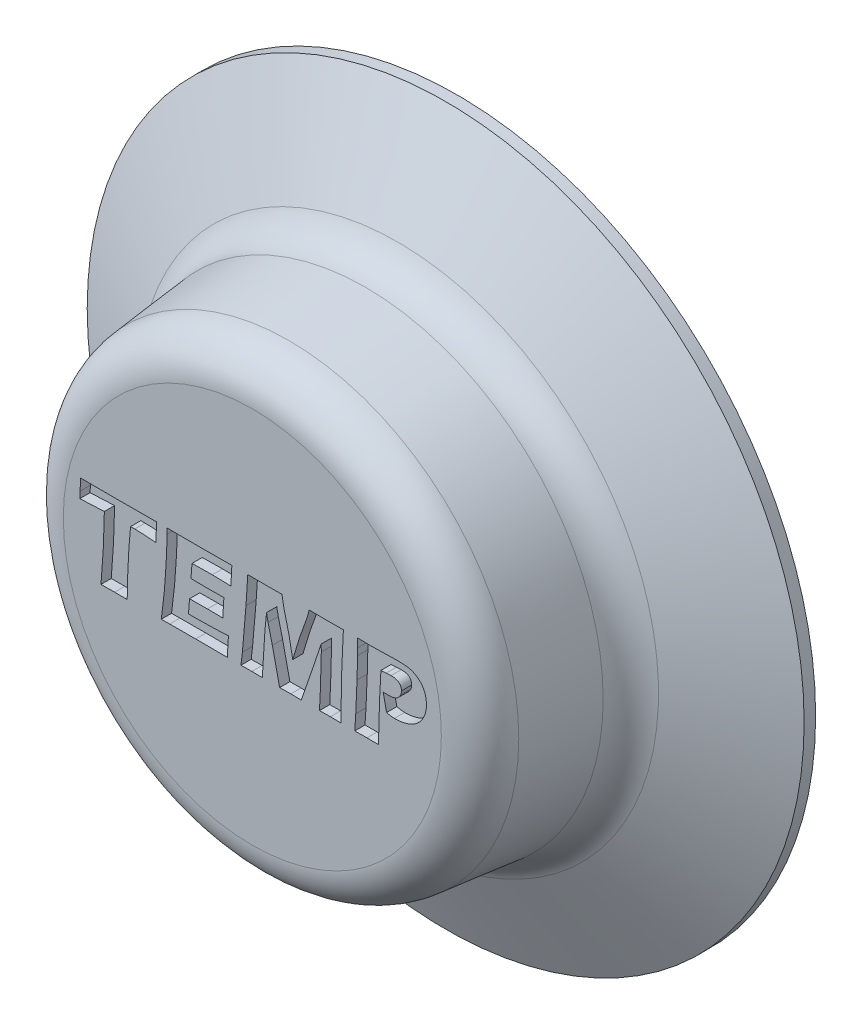
from build123d import *

# Parameters (mm, degrees)
SCHIZZO1_R                   = 17.5
ESTRUSIONE_ESTRUSIONE1_DEPTH = 10
TAGLIO_ESTRUSIONE1_START     = -7
SCHIZZO2_R                   = 17.5
SCHIZZO2_R_2                 = 12.5
TAGLIO_ESTRUSIONE1_DEPTH     = 7
SMUSSO1_SIZE                 = 2.438662943
SMUSSO1_SIZE_2               = 5
RACCORDO1_R                  = 2
TAGLIO_ESTRUSIONE2_DEPTH     = 0.5
TAGLIO_ESTRUSIONE3_DEPTH     = 8
SMUSSO3_SIZE                 = 2


with BuildPart() as part:
    # Schizzo1 → Estrusione-Estrusione1 (new body)
    with BuildSketch(Plane.XY):
        Circle(SCHIZZO1_R)
    extrude(amount=ESTRUSIONE_ESTRUSIONE1_DEPTH)

    # Schizzo2 → Taglio-Estrusione1 (cut)
    with BuildSketch(Plane.XY.offset(10).offset(TAGLIO_ESTRUSIONE1_START)):
        Circle(SCHIZZO2_R)
        Circle(SCHIZZO2_R_2, mode=Mode.SUBTRACT)
    extrude(amount=TAGLIO_ESTRUSIONE1_DEPTH, mode=Mode.SUBTRACT)

    # Smusso1
    # the kernel refuses this chamfer: 5, 2.438662943 mm, written as the material it takes off along each edge
    with BuildSketch(Plane(origin=(0, 0, 3), x_dir=(1, 0, 0), z_dir=(0, -1, 0))) as smusso1_piece_1_section:
        Polygon((17.5, -SMUSSO1_SIZE), (17.5 - SMUSSO1_SIZE_2, 0), (17.5, 0), align=None)
    smusso1_piece_1 = revolve(axis=Axis((0, 0, 3), (0, 0, 1)), mode=Mode.PRIVATE)
    smusso1_piece_1 = smusso1_piece_1 - Plane(origin=(0, 0, 3), x_dir=(1, 0, 0), z_dir=(0, 0, -1)) * Cylinder(12.5, 71, mode=Mode.PRIVATE)
    add(smusso1_piece_1, mode=Mode.SUBTRACT)

    # Smusso2: read off the stored shape, not the designer's step
    # Smusso2 outline → Smusso2 (revolve, cut)
    with BuildSketch(Plane.XZ):
        Polygon((11.028540706, 10), (11.724516951, 3.378228355), (12.5, 3), (12.5, 10), align=None)
    revolve(axis=Axis((0, 0, 0), (0, 0, 1)), mode=Mode.SUBTRACT)

    # Raccordo1
    raccordo1_edges = [part.edges().sort_by_distance(p)[0] for p in [
        (-11.028540706, 0, 10),
        (-11.724516951, 0, 3.378228355),
    ]]
    fillet(raccordo1_edges, radius=RACCORDO1_R)

    # Schizzo3 → Taglio-Estrusione2 (cut)
    with BuildSketch(Plane.XY.offset(10)):
        with BuildLine():
            add(Edge.make_bspline(
                [(-7.388888889, -1.892822573), (-7.377505654, -1.771617162), (-7.354453879, -1.526168483), (-7.326689975, -1.152761265), (-7.300352082, -0.770267216), (-7.277566086, -0.378772925), (-7.259963473, 0.021474924), (-7.244005216, 0.430605824), (-7.231813049, 0.849028689), (-7.226596004, 1.131188002), (-7.223958333, 1.273844094)],
                knots=[0, 0, 0, 0, 0.921146344, 1.86538004, 2.833160902, 3.822244263, 4.832629341, 5.864615056, 6.920377047, 8, 8, 8, 8], degree=3))
            Line((-7.223958333, 1.273844094), (-8.421006944, 1.218288539))
            Line((-8.421006944, 1.218288539), (-8.40625, 1.54033715))
            add(Edge.make_bspline(
                [(-8.40625, 1.54033715), (-8.402454403, 1.630604916), (-8.394512338, 1.819484957), (-8.390817779, 2.008496498), (-8.388888889, 2.107177427)],
                knots=[0, 0, 0, 0, 0.955821121, 2, 2, 2, 2], degree=3))
            add(Edge.make_bspline(
                [(-8.388888889, 2.107177427), (-8.318576868, 2.106520313), (-8.175061235, 2.105179061), (-7.955728798, 2.104627017), (-7.727720092, 2.103670757), (-7.491319484, 2.102813657), (-7.246238387, 2.102013711), (-6.993056482, 2.100845887), (-6.731192016, 2.101168389), (-6.553819406, 2.101123756), (-6.463541667, 2.101101039)],
                knots=[0, 0, 0, 0, 0.876488081, 1.789021852, 2.734016799, 3.718686541, 4.735817494, 5.789016475, 6.874670702, 8, 8, 8, 8], degree=3))
            Line((-6.463541667, 2.101101039), (-5.744791667, 2.104573261))
            Line((-5.744791667, 2.104573261), (-5.046875, 2.104573261))
            Line((-5.046875, 2.104573261), (-4.668402778, 2.107177427))
            Line((-4.668402778, 2.107177427), (-4.685763889, 1.822455205))
            add(Edge.make_bspline(
                [(-4.685763889, 1.822455205), (-4.687410602, 1.785992556), (-4.690547571, 1.716531621), (-4.696438008, 1.61705371), (-4.699511606, 1.52732116), (-4.702367522, 1.447177436), (-4.703759381, 1.376846822), (-4.705796845, 1.315809453), (-4.706744646, 1.264009233), (-4.70664294, 1.232466993), (-4.706597222, 1.218288539)],
                knots=[0, 0, 0, 0, 1.448901192, 2.76014038, 3.955588437, 5.012880538, 5.943546328, 6.747908458, 7.437176186, 8, 8, 8, 8], degree=3))
            add(Edge.make_bspline(
                [(-4.706597222, 1.218288539), (-4.757515566, 1.222720686), (-4.8572944, 1.231405858), (-5.003432122, 1.242566477), (-5.142895775, 1.25225033), (-5.275426877, 1.260046721), (-5.401300234, 1.26617986), (-5.520231629, 1.270528398), (-5.632220533, 1.273296467), (-5.704570309, 1.273665503), (-5.739583333, 1.273844094)],
                knots=[0, 0, 0, 0, 1.185412133, 2.322916112, 3.399205445, 4.427758314, 5.401981809, 6.321996416, 7.187945247, 8, 8, 8, 8], degree=3))
            Line((-5.739583333, 1.273844094), (-5.944444444, 1.273844094))
            add(Edge.make_bspline(
                [(-5.944444444, 1.273844094), (-5.952941435, 1.188495573), (-5.96961338, 1.021033225), (-5.992339161, 0.774536845), (-6.011591034, 0.537841018), (-6.021882061, 0.38323214), (-6.026909722, 0.307698261)],
                knots=[0, 0, 0, 0, 1.06138436, 2.082542449, 3.063229686, 4, 4, 4, 4], degree=3))
            add(Edge.make_bspline(
                [(-6.026909722, 0.307698261), (-6.039070188, 0.099105913), (-6.063029625, -0.311877949), (-6.082184048, -0.771817222), (-6.092892146, -1.069316722), (-6.097367542, -1.208204081), (-6.100389083, -1.339878731), (-6.104592871, -1.464270731), (-6.105773497, -1.581482958), (-6.107464479, -1.691724637), (-6.109798693, -1.79472391), (-6.109512475, -1.860992726), (-6.109375, -1.892822573)],
                knots=[0, 0, 0, 0, 2.84620581, 5.607802343, 6.270399841, 6.901350865, 7.500669288, 8.064527081, 8.596690644, 9.097325726, 9.566432822, 10, 10, 10, 10], degree=3))
            add(Edge.make_bspline(
                [(-6.109375, -1.892822573), (-6.147279219, -1.892169908), (-6.219323418, -1.890929394), (-6.322338828, -1.89030185), (-6.414641755, -1.889409344), (-6.496817453, -1.888501942), (-6.568288821, -1.887789409), (-6.629336664, -1.886535569), (-6.679687771, -1.886783081), (-6.709780176, -1.886757499), (-6.723090278, -1.886746184)],
                knots=[0, 0, 0, 0, 1.482402954, 2.817589569, 4.028319032, 5.091964258, 6.031155381, 6.823267612, 7.479522213, 8, 8, 8, 8], degree=3))
            add(Edge.make_bspline(
                [(-6.723090278, -1.886746184), (-6.73553234, -1.886755748), (-6.765046069, -1.886778437), (-6.815686303, -1.886540344), (-6.879338459, -1.887799423), (-6.956018033, -1.888520683), (-7.045717137, -1.889404019), (-7.148725959, -1.890317732), (-7.264472328, -1.890922603), (-7.346065598, -1.892168617), (-7.388888889, -1.892822573)],
                knots=[0, 0, 0, 0, 0.448477953, 1.063831424, 1.825272406, 2.743147011, 3.827888016, 5.058639151, 6.456260527, 8, 8, 8, 8], degree=3))
        make_face()
        with BuildLine():
            add(Edge.make_bspline(
                [(-4.444444444, -1.892822573), (-4.435878044, -1.831213501), (-4.419076912, -1.710380706), (-4.39740589, -1.532816398), (-4.374701843, -1.363162433), (-4.356515689, -1.200944493), (-4.337399876, -1.046596326), (-4.322605611, -0.899738956), (-4.306984561, -0.760995016), (-4.295306166, -0.626603199), (-4.282154997, -0.491008744), (-4.271634539, -0.347664808), (-4.25907547, -0.193786008), (-4.246788523, -0.029457608), (-4.23615894, 0.145393607), (-4.22319987, 0.330492377), (-4.212765659, 0.526181658), (-4.200370893, 0.727522401), (-4.189477005, 0.925156569), (-4.1797162, 1.109755355), (-4.172400221, 1.276746847), (-4.164490998, 1.425702635), (-4.161308302, 1.556855134), (-4.15581191, 1.669928383), (-4.154546594, 1.765450754), (-4.153925369, 1.82332362), (-4.153645833, 1.849364927)],
                knots=[0, 0, 0, 0, 1.19249449, 2.338818581, 3.429412686, 4.473928193, 5.46821108, 6.411021954, 7.303599658, 8.144847551, 8.99714345, 9.915298701, 10.900252692, 11.957113468, 13.074467758, 14.258610572, 15.514392259, 16.831414631, 18.125965857, 19.309133721, 20.375401368, 21.330583298, 22.168697699, 22.890391102, 23.50070443, 24, 24, 24, 24], degree=3))
            Line((-4.153645833, 1.849364927), (-4.157118056, 2.107177427))
            add(Edge.make_bspline(
                [(-4.157118056, 2.107177427), (-4.100116332, 2.106519937), (-3.982932453, 2.105168271), (-3.802950929, 2.104626538), (-3.61400488, 2.103665775), (-3.416666719, 2.102812167), (-3.210358776, 2.102007254), (-2.995371464, 2.100843995), (-2.771411902, 2.101169311), (-2.619212917, 2.101124083), (-2.541666667, 2.101101039)],
                knots=[0, 0, 0, 0, 0.846890532, 1.741033624, 2.673864724, 3.653981213, 4.67278578, 5.738875813, 6.847944331, 8, 8, 8, 8], degree=3))
            add(Edge.make_bspline(
                [(-2.541666667, 2.101101039), (-2.400173206, 2.100925967), (-2.125865605, 2.100586562), (-1.727430987, 2.102960826), (-1.355030946, 2.10422844), (-1.115450863, 2.10621846), (-1, 2.107177427)],
                knots=[0, 0, 0, 0, 1.101338765, 2.135120547, 3.101336221, 4, 4, 4, 4], degree=3))
            Line((-1, 2.107177427), (-1.005208333, 2.008219094))
            add(Edge.make_bspline(
                [(-1.005208333, 2.008219094), (-1.006153453, 1.998386372), (-1.008789708, 1.970959625), (-1.010411331, 1.9176166), (-1.015460168, 1.840708265), (-1.018337371, 1.781373645), (-1.019965278, 1.747802427)],
                knots=[0, 0, 0, 0, 0.454335529, 1.267293612, 2.453849006, 4, 4, 4, 4], degree=3))
            Line((-1.019965278, 1.747802427), (-1.036458333, 1.421413539))
            add(Edge.make_bspline(
                [(-1.036458333, 1.421413539), (-1.038122368, 1.38611883), (-1.041462892, 1.315265261), (-1.042176559, 1.244336517), (-1.042534722, 1.208739927)],
                knots=[0, 0, 0, 0, 0.996271834, 2, 2, 2, 2], degree=3))
            add(Edge.make_bspline(
                [(-1.042534722, 1.208739927), (-1.129332367, 1.212434846), (-1.295664578, 1.219515498), (-1.534409841, 1.226153736), (-1.75142864, 1.230863334), (-1.888886796, 1.231755065), (-1.953993056, 1.232177427)],
                knots=[0, 0, 0, 0, 1.143319042, 2.190967089, 3.14316204, 4, 4, 4, 4], degree=3))
            add(Edge.make_bspline(
                [(-1.953993056, 1.232177427), (-1.986400435, 1.232173473), (-2.048611031, 1.232165881), (-2.137731762, 1.232217636), (-2.218459749, 1.232048603), (-2.290803398, 1.232583344), (-2.355029768, 1.230907034), (-2.411175495, 1.231758123), (-2.459196439, 1.230163648), (-2.51533839, 1.230658838), (-2.589134861, 1.229675426), (-2.689815969, 1.226726581), (-2.810495866, 1.223567898), (-2.897573087, 1.220135895), (-2.944444444, 1.218288539)],
                knots=[0, 0, 0, 0, 1.177678137, 2.260721423, 3.238614876, 4.111358495, 4.889538308, 5.573012226, 6.151431894, 6.635121129, 7.613071112, 8.833217023, 10.295404764, 12, 12, 12, 12], degree=3))
            Line((-2.944444444, 1.218288539), (-2.996527778, 0.551621872))
            add(Edge.make_bspline(
                [(-2.996527778, 0.551621872), (-2.939237483, 0.550388199), (-2.819744665, 0.547815076), (-2.633685704, 0.545358712), (-2.433741594, 0.54358067), (-2.296007354, 0.543159155), (-2.224826389, 0.542941316)],
                knots=[0, 0, 0, 0, 0.890998197, 1.858393033, 2.893218922, 4, 4, 4, 4], degree=3))
            add(Edge.make_bspline(
                [(-2.224826389, 0.542941316), (-2.208911569, 0.542874741), (-2.171871462, 0.542719795), (-2.108223265, 0.544312902), (-2.028345718, 0.543184116), (-1.932013324, 0.546195471), (-1.819148324, 0.546074147), (-1.690107004, 0.548390961), (-1.544850178, 0.549942498), (-1.442708323, 0.55104235), (-1.388888889, 0.551621872)],
                knots=[0, 0, 0, 0, 0.456874731, 1.063328995, 1.827555819, 2.749761755, 3.829679432, 5.067506109, 6.454843409, 8, 8, 8, 8], degree=3))
            add(Edge.make_bspline(
                [(-1.388888889, 0.551621872), (-1.39358665, 0.486522556), (-1.403418517, 0.35027726), (-1.417398464, 0.13704228), (-1.43015038, -0.094186939), (-1.438418003, -0.254220535), (-1.442708333, -0.337267017)],
                knots=[0, 0, 0, 0, 0.879491857, 1.840674164, 2.879457706, 4, 4, 4, 4], degree=3))
            add(Edge.make_bspline(
                [(-1.442708333, -0.337267017), (-1.48205933, -0.336611838), (-1.55873299, -0.33533525), (-1.670139722, -0.334746029), (-1.77459506, -0.333818644), (-1.871817326, -0.332937618), (-1.962095696, -0.332173761), (-2.045425516, -0.33096013), (-2.121817392, -0.331240282), (-2.170428325, -0.331206646), (-2.193576389, -0.331190628)],
                knots=[0, 0, 0, 0, 1.257885333, 2.450933417, 3.560750778, 4.596585635, 5.558438414, 6.446309642, 7.260147448, 8, 8, 8, 8], degree=3))
            add(Edge.make_bspline(
                [(-2.193576389, -0.331190628), (-2.260417295, -0.331043243), (-2.398152433, -0.330739534), (-2.610530953, -0.333166363), (-2.834495261, -0.334450053), (-2.987558612, -0.336312761), (-3.065972222, -0.337267017)],
                knots=[0, 0, 0, 0, 0.919373236, 1.894498551, 2.921361849, 4, 4, 4, 4], degree=3))
            Line((-3.065972222, -0.337267017), (-3.118055556, -1.003933684))
            Line((-3.118055556, -1.003933684), (-2.791666667, -1.003933684))
            add(Edge.make_bspline(
                [(-2.791666667, -1.003933684), (-2.778066648, -1.0039896), (-2.747391813, -1.004115721), (-2.696761035, -1.002915023), (-2.636286144, -1.002111234), (-2.566253896, -1.001486982), (-2.486403777, -0.999422041), (-2.396703644, -0.997738977), (-2.297445032, -0.996251601), (-2.228007847, -0.994453559), (-2.191840278, -0.993517017)],
                knots=[0, 0, 0, 0, 0.54404726, 1.227098294, 2.02588985, 2.963574664, 4.028769848, 5.221268376, 6.55264914, 8, 8, 8, 8], degree=3))
            Line((-2.191840278, -0.993517017), (-1.604166667, -0.976155906))
            add(Edge.make_bspline(
                [(-1.604166667, -0.976155906), (-1.578703369, -0.975013007), (-1.520241942, -0.972389015), (-1.421794943, -0.96758351), (-1.301513631, -0.958068032), (-1.214124258, -0.95178836), (-1.166666667, -0.948378128)],
                knots=[0, 0, 0, 0, 0.697681804, 1.601814284, 2.697643508, 4, 4, 4, 4], degree=3))
            add(Edge.make_bspline(
                [(-1.166666667, -0.948378128), (-1.177578217, -1.103151296), (-1.199759534, -1.4177787), (-1.215805688, -1.732778919), (-1.223958333, -1.892822573)],
                knots=[0, 0, 0, 0, 0.983850526, 2, 2, 2, 2], degree=3))
            add(Edge.make_bspline(
                [(-1.223958333, -1.892822573), (-1.344038851, -1.891864602), (-1.58998494, -1.88990251), (-1.967303739, -1.888628419), (-2.36139802, -1.886243865), (-2.629629235, -1.886576472), (-2.766493056, -1.886746184)],
                knots=[0, 0, 0, 0, 0.934172669, 1.913350473, 2.935296078, 4, 4, 4, 4], degree=3))
            Line((-2.766493056, -1.886746184), (-4.034722222, -1.88935035))
            Line((-4.034722222, -1.88935035), (-4.444444444, -1.892822573))
        make_face()
        with BuildLine():
            Line((-0.555555556, -1.892822573), (-0.485243056, -1.300808684))
            Line((-0.485243056, -1.300808684), (-0.309895833, 0.753010761))
            Line((-0.309895833, 0.753010761), (-0.222222222, 2.107177427))
            add(Edge.make_bspline(
                [(-0.222222222, 2.107177427), (-0.177373432, 2.106522933), (-0.090282499, 2.105251984), (0.036748364, 2.104648833), (0.156539441, 2.103723818), (0.268808079, 2.102852859), (0.373553857, 2.102076335), (0.470773118, 2.100867951), (0.560764118, 2.101151822), (0.618344982, 2.101117448), (0.645833333, 2.101101039)],
                knots=[0, 0, 0, 0, 1.24006301, 2.408052532, 3.512045717, 4.552042762, 5.512044964, 6.408051623, 7.240024644, 8, 8, 8, 8], degree=3))
            add(Edge.make_bspline(
                [(0.645833333, 2.101101039), (0.668981404, 2.101116177), (0.718171055, 2.101148347), (0.796298901, 2.100873718), (0.883390306, 2.102100787), (0.978877191, 2.102841339), (1.083043732, 2.103741693), (1.195601122, 2.104653158), (1.317134457, 2.10525837), (1.401042437, 2.10652319), (1.444444444, 2.107177427)],
                knots=[0, 0, 0, 0, 0.695626121, 1.478205507, 2.347781634, 3.313002045, 4.347782434, 5.478208324, 6.69558509, 8, 8, 8, 8], degree=3))
            add(Edge.make_bspline(
                [(1.444444444, 2.107177427), (1.450115703, 2.067808325), (1.460758693, 1.993926137), (1.477381516, 1.890683681), (1.492228532, 1.802454655), (1.503184765, 1.736289917), (1.514540748, 1.685317109), (1.523824878, 1.640924979), (1.536100932, 1.588860786), (1.551114873, 1.529099193), (1.567195819, 1.461505733), (1.586659683, 1.386363551), (1.608410849, 1.303408202), (1.638789678, 1.184044403), (1.678137298, 1.036266889), (1.720598509, 0.865808592), (1.758197705, 0.708156344), (1.785517952, 0.581700829), (1.808574487, 0.479201329), (1.82522498, 0.391260558), (1.845605551, 0.291576033), (1.867302884, 0.179302328), (1.890304355, 0.054455376), (1.916980926, -0.082472122), (1.943218585, -0.232008363), (1.962304125, -0.335545613), (1.972222222, -0.38935035)],
                knots=[0, 0, 0, 0, 1.121689629, 2.105023458, 2.948819624, 3.645098596, 3.995596923, 4.421324541, 4.924073136, 5.503946891, 6.159034259, 6.883388276, 7.692870619, 8.577539208, 10.356821093, 12.005394556, 13.531393412, 14.927151271, 15.653799732, 16.493958146, 17.450936852, 18.523156182, 19.718666175, 21.030973672, 22.457099446, 24, 24, 24, 24], degree=3))
            add(Edge.make_bspline(
                [(1.972222222, -0.38935035), (1.992993591, -0.315258946), (2.033023385, -0.172472801), (2.091818295, 0.033413881), (2.148336726, 0.222923342), (2.203527372, 0.4011998), (2.260376651, 0.577191332), (2.322250396, 0.760096607), (2.390771173, 0.953894631), (2.451451288, 1.120388479), (2.500740441, 1.252661558), (2.534399144, 1.344458707), (2.564876159, 1.427177107), (2.59199737, 1.500495049), (2.614196554, 1.56535881), (2.6345013, 1.620300726), (2.650150815, 1.666696159), (2.667122271, 1.719102655), (2.688724306, 1.7862885), (2.715478695, 1.877790014), (2.745556802, 1.986677364), (2.766554537, 2.065204731), (2.777777778, 2.107177427)],
                knots=[0, 0, 0, 0, 1.759136125, 3.390140436, 4.894942237, 6.280049498, 7.65653699, 9.122929779, 10.694136454, 12.355694312, 13.174055432, 13.921196483, 14.590911835, 15.189411885, 15.70825551, 16.158122565, 16.528384033, 16.827524369, 17.417482396, 18.141693965, 19.006739711, 20, 20, 20, 20], degree=3))
            add(Edge.make_bspline(
                [(2.777777778, 2.107177427), (2.923609601, 2.105514525), (3.212084563, 2.102225081), (3.500577258, 2.101472948), (3.643229167, 2.101101039)],
                knots=[0, 0, 0, 0, 1.011053586, 2, 2, 2, 2], degree=3))
            add(Edge.make_bspline(
                [(3.643229167, 2.101101039), (3.668402697, 2.101117367), (3.721353917, 2.101151712), (3.804111353, 2.100866666), (3.89380717, 2.10207989), (3.990451175, 2.102851519), (4.094039271, 2.103721692), (4.204860321, 2.104656088), (4.32234315, 2.105243628), (4.403067944, 2.10652212), (4.444444444, 2.107177427)],
                knots=[0, 0, 0, 0, 0.754034144, 1.586071821, 2.478820984, 3.440903587, 4.480986795, 5.581737427, 6.760489332, 8, 8, 8, 8], degree=3))
            add(Edge.make_bspline(
                [(4.444444444, 2.107177427), (4.43980439, 2.026448939), (4.430674413, 1.867603986), (4.417416843, 1.633834675), (4.406330044, 1.408402682), (4.395960948, 1.191965328), (4.386150723, 0.98423388), (4.378282379, 0.785155781), (4.372411394, 0.594743333), (4.36889872, 0.470604025), (4.3671875, 0.410128816)],
                knots=[0, 0, 0, 0, 1.14232748, 2.247694209, 3.307727716, 4.330816183, 5.308798154, 6.245592102, 7.145329676, 8, 8, 8, 8], degree=3))
            add(Edge.make_bspline(
                [(4.3671875, 0.410128816), (4.363896164, 0.299020579), (4.357570892, 0.085493351), (4.350212088, -0.221239033), (4.342654232, -0.500732738), (4.338293547, -0.753078573), (4.332011905, -0.978157072), (4.330001981, -1.176386319), (4.328026955, -1.347391037), (4.327498571, -1.452428617), (4.327256944, -1.500461461)],
                knots=[0, 0, 0, 0, 1.395962146, 2.682752735, 3.853206248, 4.907241736, 5.852288416, 6.680872795, 7.396773696, 8, 8, 8, 8], degree=3))
            add(Edge.make_bspline(
                [(4.327256944, -1.500461461), (4.327151309, -1.522163954), (4.326904799, -1.572808889), (4.329449135, -1.659887603), (4.330622336, -1.768986578), (4.332376863, -1.849131853), (4.333333333, -1.892822573)],
                knots=[0, 0, 0, 0, 0.663620401, 1.548624549, 2.663647262, 4, 4, 4, 4], degree=3))
            add(Edge.make_bspline(
                [(4.333333333, -1.892822573), (4.30353121, -1.892168995), (4.246245348, -1.890912684), (4.16348275, -1.890296837), (4.087673125, -1.889396079), (4.018807476, -1.888501906), (3.957174382, -1.887755092), (3.902492509, -1.88652569), (3.85474502, -1.886789395), (3.825231371, -1.886759814), (3.811631944, -1.886746184)],
                knots=[0, 0, 0, 0, 1.371188818, 2.635709234, 3.807065195, 4.858639736, 5.803743737, 6.642379608, 7.374429819, 8, 8, 8, 8], degree=3))
            add(Edge.make_bspline(
                [(3.811631944, -1.886746184), (3.773147143, -1.886605616), (3.692411905, -1.886310727), (3.565107131, -1.88877256), (3.425629969, -1.890037037), (3.328413203, -1.891868601), (3.277777778, -1.892822573)],
                knots=[0, 0, 0, 0, 0.864967751, 1.814570307, 2.861717317, 4, 4, 4, 4], degree=3))
            add(Edge.make_bspline(
                [(3.277777778, -1.892822573), (3.279893311, -1.867076788), (3.284739027, -1.808105016), (3.290550436, -1.707958208), (3.296299028, -1.584952929), (3.303559546, -1.439435167), (3.310102392, -1.271291155), (3.318246602, -1.08034373), (3.325899016, -0.866504268), (3.333293586, -0.637323677), (3.340974136, -0.408161893), (3.347743883, -0.193747125), (3.354363961, -0.001641081), (3.357970606, 0.167956583), (3.362893953, 0.315203738), (3.365698437, 0.439920871), (3.366139612, 0.54236446), (3.366868273, 0.603126823), (3.3671875, 0.629746872)],
                knots=[0, 0, 0, 0, 0.491182344, 1.125073208, 1.907293313, 2.832661805, 3.895442533, 5.106875452, 6.466749385, 7.964088258, 9.466926045, 10.826610753, 12.043142943, 13.121868392, 14.052098262, 14.844545409, 15.493794258, 16, 16, 16, 16], degree=3))
            add(Edge.make_bspline(
                [(3.3671875, 0.629746872), (3.367313209, 0.651739069), (3.367587821, 0.699781088), (3.365116436, 0.777600147), (3.363864327, 0.867024731), (3.362064506, 0.930385176), (3.361111111, 0.963948261)],
                knots=[0, 0, 0, 0, 0.789445484, 1.72454594, 2.794653999, 4, 4, 4, 4], degree=3))
            Line((3.361111111, 0.963948261), (2.961805556, -0.228760073))
            Line((2.961805556, -0.228760073), (2.388888889, -1.892822573))
            add(Edge.make_bspline(
                [(2.388888889, -1.892822573), (2.359086759, -1.892169719), (2.302090155, -1.890921135), (2.219906393, -1.890294132), (2.145254005, -1.889405998), (2.077546021, -1.888492834), (2.017359347, -1.887767616), (1.964124591, -1.886525933), (1.918113067, -1.886788928), (1.889756832, -1.886759635), (1.876736111, -1.886746184)],
                knots=[0, 0, 0, 0, 1.396749587, 2.671284971, 3.850919318, 4.894982585, 5.844147815, 6.671304252, 7.389884606, 8, 8, 8, 8], degree=3))
            add(Edge.make_bspline(
                [(1.876736111, -1.886746184), (1.843170413, -1.886626053), (1.768511594, -1.886358851), (1.644390729, -1.888879285), (1.496811751, -1.890081567), (1.390334593, -1.891866845), (1.333333333, -1.892822573)],
                knots=[0, 0, 0, 0, 0.741156493, 1.648524254, 2.741165879, 4, 4, 4, 4], degree=3))
            Line((1.333333333, -1.892822573), (0.9765625, -0.280843406))
            Line((0.9765625, -0.280843406), (0.767361111, 0.577663539))
            add(Edge.make_bspline(
                [(0.767361111, 0.577663539), (0.76294976, 0.596164988), (0.753260651, 0.636801637), (0.74149369, 0.692350094), (0.732014628, 0.748714542), (0.721273771, 0.806526167), (0.708317359, 0.87795681), (0.699315562, 0.930375012), (0.694444444, 0.958739927)],
                knots=[0, 0, 0, 0, 0.882226797, 1.937726131, 2.632778453, 3.53309321, 4.665089601, 6, 6, 6, 6], degree=3))
            Line((0.694444444, 0.958739927), (0.614583333, 0.147107983))
            Line((0.614583333, 0.147107983), (0.509548611, -1.517822573))
            Line((0.509548611, -1.517822573), (0.5, -1.892822573))
            add(Edge.make_bspline(
                [(0.5, -1.892822573), (0.467593626, -1.892168637), (0.40567759, -1.890919218), (0.317417856, -1.890312753), (0.238136045, -1.889399546), (0.1681129, -1.8885132), (0.107347423, -1.887789356), (0.056138508, -1.886539895), (0.014177929, -1.886781934), (-0.010706114, -1.886757139), (-0.021701389, -1.886746184)],
                knots=[0, 0, 0, 0, 1.490962124, 2.848651433, 4.05993819, 5.138133576, 6.069931432, 6.855336572, 7.494218486, 8, 8, 8, 8], degree=3))
            add(Edge.make_bspline(
                [(-0.021701389, -1.886746184), (-0.035879521, -1.886760014), (-0.066261233, -1.886789651), (-0.115455318, -1.88652916), (-0.171584178, -1.887753281), (-0.234953322, -1.888501635), (-0.30526582, -1.889388105), (-0.382522056, -1.890302793), (-0.466731354, -1.890910342), (-0.525174712, -1.892168526), (-0.555555556, -1.892822573)],
                knots=[0, 0, 0, 0, 0.637346006, 1.365741442, 2.211300478, 3.160905042, 4.214557299, 5.372258831, 6.634010827, 8, 8, 8, 8], degree=3))
        make_face()
        with BuildLine():
            Line((5, -1.892822573), (5.048611111, -1.142822573))
            Line((5.048611111, -1.142822573), (5.111111111, 0.322455205))
            Line((5.111111111, 0.322455205), (5.138020833, 1.359781594))
            add(Edge.make_bspline(
                [(5.138020833, 1.359781594), (5.139033563, 1.415625), (5.141053666, 1.527016512), (5.141346852, 1.638425942), (5.141493056, 1.693982983)],
                knots=[0, 0, 0, 0, 1.002651018, 2, 2, 2, 2], degree=3))
            add(Edge.make_bspline(
                [(5.141493056, 1.693982983), (5.141549714, 1.718288819), (5.141679222, 1.773846354), (5.140407035, 1.867013812), (5.139906471, 1.980445663), (5.138683831, 2.062618047), (5.138020833, 2.107177427)],
                knots=[0, 0, 0, 0, 0.705850527, 1.613411536, 2.705831575, 4, 4, 4, 4], degree=3))
            add(Edge.make_bspline(
                [(5.138020833, 2.107177427), (5.200809466, 2.105978212), (5.320018155, 2.103701416), (5.489000731, 2.101115014), (5.63859606, 2.09926415), (5.731770446, 2.098740706), (5.775173611, 2.098496872)],
                knots=[0, 0, 0, 0, 1.182641517, 2.245329129, 3.18262655, 4, 4, 4, 4], degree=3))
            add(Edge.make_bspline(
                [(5.775173611, 2.098496872), (5.817131001, 2.098677445), (5.908575611, 2.099070997), (6.056135377, 2.102208078), (6.225436703, 2.105095465), (6.409720567, 2.11156578), (6.597478111, 2.118053194), (6.775750816, 2.12086506), (6.938646929, 2.124031428), (7.041954582, 2.124374961), (7.091145833, 2.124538539)],
                knots=[0, 0, 0, 0, 0.765009043, 1.667309494, 2.691032031, 3.852295188, 5.029377845, 6.1163973, 7.103098658, 8, 8, 8, 8], degree=3))
            add(Edge.make_bspline(
                [(7.091145833, 2.124538539), (7.123556048, 2.124406728), (7.186362026, 2.1241513), (7.277214535, 2.12121295), (7.361744886, 2.11809208), (7.439618319, 2.112938303), (7.510844836, 2.106097567), (7.575451283, 2.097562817), (7.633560494, 2.086941692), (7.702535401, 2.072577993), (7.781459545, 2.047508331), (7.872203925, 2.013560673), (7.956849358, 1.969260796), (8.037733529, 1.920407533), (8.112078729, 1.864763008), (8.180391899, 1.804470106), (8.242140968, 1.739736487), (8.296074887, 1.669456991), (8.344322779, 1.595318652), (8.385937147, 1.515918374), (8.421871526, 1.431575429), (8.459051154, 1.312759729), (8.492438186, 1.158693218), (8.497475527, 1.033010687), (8.5, 0.97002465)],
                knots=[0, 0, 0, 0, 1.025945388, 1.988123339, 2.877385044, 3.703602527, 4.458277291, 5.142268143, 5.765744602, 6.328088491, 7.371267642, 8.383380536, 9.391131838, 10.390270796, 11.372214793, 12.326116638, 13.27211351, 14.19920735, 15.126572654, 16.068970624, 17.033587118, 18.024292949, 20.007566921, 22, 22, 22, 22], degree=3))
            add(Edge.make_bspline(
                [(8.5, 0.97002465), (8.499190478, 0.937602285), (8.497590312, 0.873513686), (8.489131272, 0.778296141), (8.473357622, 0.685519322), (8.451385774, 0.59451973), (8.423973419, 0.505638924), (8.389927419, 0.418769985), (8.348545135, 0.334917735), (8.303410119, 0.252420298), (8.250915131, 0.174413524), (8.194061774, 0.100785327), (8.131706842, 0.032208577), (8.0640894, -0.030727077), (7.991830336, -0.089426742), (7.913972445, -0.142219641), (7.831801548, -0.191298035), (7.71404776, -0.24743185), (7.558680702, -0.306674214), (7.361289045, -0.356998653), (7.152524152, -0.386706089), (7.00964553, -0.390754011), (6.936631944, -0.392822573)],
                knots=[0, 0, 0, 0, 0.83389117, 1.648334911, 2.455677992, 3.251556081, 4.054084498, 4.845812729, 5.647823576, 6.457255517, 7.262091689, 8.062824429, 8.847634497, 9.642538098, 10.436221906, 11.239060706, 12.059599653, 12.894883905, 14.590485112, 16.326580622, 18.1228156, 20, 20, 20, 20], degree=3))
            add(Edge.make_bspline(
                [(6.936631944, -0.392822573), (6.907957455, -0.392104445), (6.848410066, -0.390613131), (6.756229129, -0.379437149), (6.657684239, -0.362104805), (6.590483493, -0.345761523), (6.555555556, -0.337267017)],
                knots=[0, 0, 0, 0, 0.891191392, 1.85070849, 2.882894542, 4, 4, 4, 4], degree=3))
            add(Edge.make_bspline(
                [(6.555555556, -0.337267017), (6.551576171, -0.312660342), (6.542713106, -0.257855237), (6.526341554, -0.167766498), (6.503913226, -0.062121729), (6.480547865, 0.054459789), (6.454127509, 0.170222353), (6.431349669, 0.275539964), (6.409798919, 0.363787926), (6.395348634, 0.416808739), (6.388888889, 0.440510761)],
                knots=[0, 0, 0, 0, 0.751818693, 1.674484718, 2.761345209, 4.009110707, 5.260533383, 6.342512397, 7.259049334, 8, 8, 8, 8], degree=3))
            add(Edge.make_bspline(
                [(6.388888889, 0.440510761), (6.434606481, 0.440510761), (6.52806713, 0.440510761), (6.621527778, 0.440510761), (6.669270833, 0.440510761)],
                knots=[0, 0, 0, 0, 0.978328173, 2, 2, 2, 2], degree=3))
            add(Edge.make_bspline(
                [(6.669270833, 0.440510761), (6.694164135, 0.441141567), (6.742288344, 0.442361055), (6.811999992, 0.447992711), (6.876846121, 0.459184772), (6.936464283, 0.475921161), (6.991638317, 0.495552713), (7.041870536, 0.520061777), (7.087080634, 0.54952099), (7.139685213, 0.594490363), (7.194727696, 0.658200416), (7.243523012, 0.744146003), (7.272497676, 0.839162069), (7.275988072, 0.905010671), (7.277777778, 0.93877465)],
                knots=[0, 0, 0, 0, 1.010430136, 1.953382921, 2.83560055, 3.675957016, 4.463462315, 5.209151543, 5.938671894, 6.646805833, 8.012118454, 9.331675714, 10.631812344, 12, 12, 12, 12], degree=3))
            add(Edge.make_bspline(
                [(7.277777778, 0.93877465), (7.276204724, 0.971072349), (7.273202687, 1.03270972), (7.247790014, 1.119716284), (7.202877161, 1.194849841), (7.136375807, 1.251346047), (7.059401623, 1.295118785), (6.97013234, 1.317094482), (6.872704366, 1.327792018), (6.804433989, 1.328842541), (6.768229167, 1.32939965)],
                knots=[0, 0, 0, 0, 1.049792206, 2.003437776, 2.921047842, 3.855045954, 4.812035052, 5.778618266, 6.821967367, 8, 8, 8, 8], degree=3))
            add(Edge.make_bspline(
                [(6.768229167, 1.32939965), (6.730608309, 1.329017224), (6.653608316, 1.328234498), (6.576672634, 1.324985073), (6.537326389, 1.323323261)],
                knots=[0, 0, 0, 0, 0.977165234, 2, 2, 2, 2], degree=3))
            Line((6.537326389, 1.323323261), (6.277777778, 1.30596215))
            add(Edge.make_bspline(
                [(6.277777778, 1.30596215), (6.270490195, 1.207604471), (6.255514979, 1.005489791), (6.239159178, 0.694032658), (6.22296447, 0.366806007), (6.215007775, 0.143358038), (6.2109375, 0.029052427)],
                knots=[0, 0, 0, 0, 0.925509763, 1.901825176, 2.926671139, 4, 4, 4, 4], degree=3))
            add(Edge.make_bspline(
                [(6.2109375, 0.029052427), (6.209249761, -0.023032536), (6.205967938, -0.124312159), (6.200375567, -0.272148484), (6.196439344, -0.411928034), (6.191701898, -0.543851191), (6.188516234, -0.668000503), (6.185096306, -0.784032419), (6.181297428, -0.891942386), (6.178952939, -0.991784604), (6.176407299, -1.083800265), (6.173456914, -1.167695037), (6.172103496, -1.243522409), (6.16996629, -1.311215922), (6.169350575, -1.371122779), (6.168556798, -1.423206616), (6.167350619, -1.467181328), (6.167477973, -1.493805803), (6.167534722, -1.505669795)],
                knots=[0, 0, 0, 0, 1.629174984, 3.167943652, 4.625043436, 6.000771242, 7.294847774, 8.507544743, 9.629825753, 10.670463684, 11.629718122, 12.507594635, 13.294800036, 14.00061589, 14.624851849, 15.167684107, 15.629116132, 16, 16, 16, 16], degree=3))
            Line((6.167534722, -1.505669795), (6.167534722, -1.892822573))
            Line((6.167534722, -1.892822573), (5.596354167, -1.886746184))
            add(Edge.make_bspline(
                [(5.596354167, -1.886746184), (5.584490822, -1.886756588), (5.557002584, -1.886780697), (5.510412846, -1.886537533), (5.45254836, -1.887803702), (5.383680926, -1.888506056), (5.303530671, -1.889410181), (5.212385202, -1.890310732), (5.109948404, -1.890927809), (5.037904214, -1.892169361), (5, -1.892822573)],
                knots=[0, 0, 0, 0, 0.477407891, 1.106189015, 1.874787485, 2.80638785, 3.877707861, 5.100393271, 6.474445807, 8, 8, 8, 8], degree=3))
        make_face()
    extrude(amount=-TAGLIO_ESTRUSIONE2_DEPTH, mode=Mode.SUBTRACT)

    # Schizzo5 → Taglio-Estrusione3 (cut)
    with BuildSketch(Plane(origin=(0, 0, 0), x_dir=(-1, 0, 0), z_dir=(0, 0, -1))):
        with BuildLine():
            Line((1.6, 2.537715508), (1.6, -2.537715508))
            ThreePointArc((1.6, -2.537715508), (-3, 0), (1.6, 2.537715508))
        make_face()
    extrude(amount=-TAGLIO_ESTRUSIONE3_DEPTH, mode=Mode.SUBTRACT)

    # Smusso3
    smusso3_edges = [part.edges().sort_by_distance(p)[0] for p in [
        (3, 0, 0),
        (-1.6, 0, 0),
    ]]
    chamfer(smusso3_edges, length=SMUSSO3_SIZE)


solid = part.part
